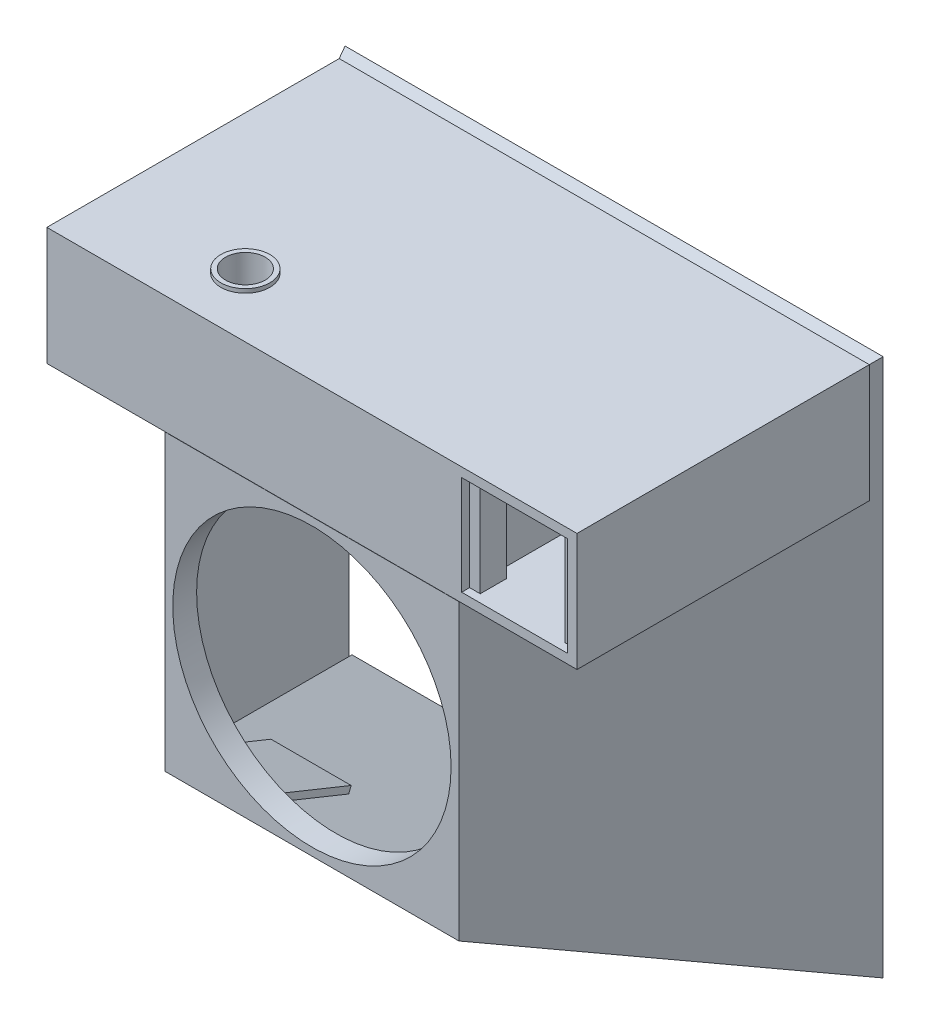
from build123d import *

# Parameters (mm, degrees)
SKETCH4_W            = 203
SKETCH4_H            = 203
BOSS_EXTRUDE4_DEPTH  = 114
BOSS_EXTRUDE4_TAPER  = 22
SKETCH7_R            = 52.5
CUT_EXTRUDE2_DEPTH   = 89
SKETCH12_W           = 200
SKETCH12_H           = 200
CUT_EXTRUDE3_DEPTH   = 105
CUT_EXTRUDE3_DRAFT   = -22
BOSS_EXTRUDE9_REACH  = 185.304
SKETCH23_W           = 200
SKETCH23_H           = 44.466490307
SKETCH28_W           = 193
SKETCH28_H           = 37.466490307
CUT_EXTRUDE6_DEPTH   = 108
SKETCH31_W           = 3
SKETCH31_H           = 37.466490307
BOSS_EXTRUDE11_DEPTH = 108
SKETCH33_W           = 14
SKETCH33_H           = 37.466490307
CUT_EXTRUDE8_DEPTH   = 10
SKETCH36_W           = 150
SKETCH36_H           = 37.466490307
BOSS_EXTRUDE12_DEPTH = 3
SKETCH44_W           = 10
SKETCH44_H           = 37.466490307
BOSS_EXTRUDE16_DEPTH = 4
SKETCH47_W           = 10
SKETCH47_H           = 37.466490307
BOSS_EXTRUDE17_DEPTH = 4
WRAP1_START          = -1
WRAP1_DEPTH          = 1
BOSS_EXTRUDE18_DEPTH = 3
SKETCH61_W           = 25.5
SKETCH61_H           = 26
CUT_EXTRUDE10_DEPTH  = 5.5
SKETCH62_W           = 30.230238596
SKETCH62_H           = 29.812668185
BOSS_EXTRUDE19_DEPTH = 2.5
SKETCH63_W           = 11.364617939
SKETCH63_H           = 5.008060822
CUT_EXTRUDE11_DEPTH  = 5
BOSS_EXTRUDE24_START = -45.96649
SKETCH64_R           = 9.25
SKETCH64_R_2         = 7.5
BOSS_EXTRUDE24_DEPTH = 42.46649
SKETCH68_R           = 7.5
CUT_EXTRUDE15_DEPTH  = 44.466490307


# Read off the part's stored shape, not the designer's step: Wrap1
with BuildPart() as part:
    # Sketch4 → Boss-Extrude4 (new body)
    with BuildSketch(Plane.XY):
        Rectangle(SKETCH4_W, SKETCH4_H)
    extrude(amount=BOSS_EXTRUDE4_DEPTH, taper=BOSS_EXTRUDE4_TAPER)

    # Sketch7 → Cut-Extrude2 (cut)
    with BuildSketch(Plane.XY.offset(114)):
        Circle(SKETCH7_R)
    extrude(amount=-CUT_EXTRUDE2_DEPTH, mode=Mode.SUBTRACT)


with BuildPart() as cut_extrude3_tool:
    # Sketch12 → Cut-Extrude3 (with draft: the straight prism first)
    with BuildSketch(Plane(origin=(0, 0, 0), x_dir=(-1, 0, 0), z_dir=(0, 0, -1))):
        Rectangle(SKETCH12_W, SKETCH12_H)
    extrude(amount=-CUT_EXTRUDE3_DEPTH)
    # Cut-Extrude3: the draft: its side faces are tilted about the plane it starts from
    cut_extrude3_sides = [cut_extrude3_tool.faces().sort_by_distance(p)[0] for p in [
        (100, 0, 52.5),
        (0, -100, 52.5),
        (-100, 0, 52.5),
        (0, 100, 52.5),
    ]]
    draft(cut_extrude3_sides, Plane(origin=(0, 0, 0), x_dir=(-1, 0, 0), z_dir=(0, 0, -1)), CUT_EXTRUDE3_DRAFT)


with BuildPart() as part_1:
    add(part.part)

    # Cut-Extrude3: cut by cut_extrude3_tool
    add(cut_extrude3_tool.part, mode=Mode.SUBTRACT)

    # Boss-Extrude9: up to this face of the body (flat: up to its plane)
    boss_extrude9_end = Plane(part_1.part.faces().sort_by_distance((-53.872901683, 0, 114))[0])
    # Sketch23 → Boss-Extrude9 (add, up to the picked face)
    with BuildSketch(Plane(origin=(0, 0, 0), x_dir=(-1, 0, 0), z_dir=(0, 0, -1)), mode=Mode.PRIVATE) as boss_extrude9_sk1:
        with Locations((0, 77.766754847)):
            Rectangle(SKETCH23_W, SKETCH23_H)
    boss_extrude9_tool1 = split(extrude(boss_extrude9_sk1.sketch, amount=-BOSS_EXTRUDE9_REACH, mode=Mode.PRIVATE), bisect_by=boss_extrude9_end, keep=Keep.BOTH, mode=Mode.PRIVATE)
    add(boss_extrude9_tool1.solids().sort_by(Axis((0, 77.766755, 0), (0, 0, 1)))[0])

    # Sketch28 → Cut-Extrude6 (cut)
    with BuildSketch(Plane.XY.offset(114)):
        with Locations((0, 77.766754847)):
            Rectangle(SKETCH28_W, SKETCH28_H)
    extrude(amount=-CUT_EXTRUDE6_DEPTH, mode=Mode.SUBTRACT)

    # Sketch31 → Boss-Extrude11 (add)
    with BuildSketch(Plane.XY.offset(114)):
        with Locations((55, 77.766754847)):
            Rectangle(SKETCH31_W, SKETCH31_H)
    extrude(amount=-BOSS_EXTRUDE11_DEPTH)

    # Sketch33 → Cut-Extrude8 (cut)
    with BuildSketch(Plane(origin=(56.5, 0, 0), x_dir=(0, 0, -1), z_dir=(1, 0, 0))):
        with Locations((-13, 77.766754847)):
            Rectangle(SKETCH33_W, SKETCH33_H)
    extrude(amount=-CUT_EXTRUDE8_DEPTH, mode=Mode.SUBTRACT)

    # Sketch36 → Boss-Extrude12 (add)
    with BuildSketch(Plane.XY.offset(114)):
        with Locations((-21.5, 77.766754847)):
            Rectangle(SKETCH36_W, SKETCH36_H)
    extrude(amount=-BOSS_EXTRUDE12_DEPTH)

    # Sketch44 → Boss-Extrude16 (add)
    with BuildSketch(Plane(origin=(56.5, 0, 0), x_dir=(0, 0, -1), z_dir=(1, 0, 0))):
        with Locations((-106, 77.766754847)):
            Rectangle(SKETCH44_W, SKETCH44_H)
    extrude(amount=BOSS_EXTRUDE16_DEPTH)

    # Sketch47 → Boss-Extrude17 (add)
    with BuildSketch(Plane.ZY.offset(-96.5)):
        with Locations((106, 77.766754847)):
            Rectangle(SKETCH47_W, SKETCH47_H)
    extrude(amount=BOSS_EXTRUDE17_DEPTH)

    # Wrap1 outline → Wrap1 (cut)
    with BuildSketch(Plane(origin=(0, -87.256494867, 35.253912301), x_dir=(1, 0, 0), z_dir=(0, -0.9271838545667873, 0.3746065934159124)).offset(WRAP1_START)):
        with BuildLine():
            Line((-4.680234593, 75.476918312), (-5.241387393, 74.994297512))
            Line((-5.241387393, 74.994297512), (-5.341387393, 58.729844912))
            Line((-5.341387393, 58.729844912), (-5.441387393, 42.465392112))
            Line((-5.441387393, 42.465392112), (-6.341387393, 42.040077912))
            ThreePointArc((-6.341387393, 42.040077912), (-6.529680479, 41.952409721), (-6.718963793, 41.866900512))
            ThreePointArc((-6.718963793, 41.866900512), (-6.91363203, 41.781536657), (-7.109199993, 41.698254712))
            ThreePointArc((-7.109199993, 41.698254712), (-7.283738522, 41.626115501), (-7.459034993, 41.555838112))
            ThreePointArc((-7.459034993, 41.555838112), (-7.574470195, 41.512660542), (-7.691387393, 41.473673912))
            Line((-7.691387393, 41.473673912), (-8.141387393, 41.332584112))
            Line((-8.141387393, 41.332584112), (-8.141387393, 53.919089912))
            Line((-8.141387393, 53.919089912), (-8.148984393, 62.129109112))
            ThreePointArc((-8.148984393, 62.129109112), (-8.161799654, 63.524890433), (-8.195074593, 64.920333912))
            ThreePointArc((-8.195074593, 64.920333912), (-8.231464824, 65.658378419), (-8.294533793, 66.394623112))
            ThreePointArc((-8.294533793, 66.394623112), (-8.377628864, 66.727977707), (-8.550053593, 67.025130512))
            ThreePointArc((-8.550053593, 67.025130512), (-8.868939679, 67.331350627), (-9.259677793, 67.538190712))
            ThreePointArc((-9.259677793, 67.538190712), (-9.729366325, 67.653556638), (-10.212837593, 67.666677112))
            ThreePointArc((-10.212837593, 67.666677112), (-10.685797535, 67.577066864), (-11.128743793, 67.388600112))
            ThreePointArc((-11.128743793, 67.388600112), (-11.476401599, 67.123101366), (-11.735458593, 66.770617312))
            ThreePointArc((-11.735458593, 66.770617312), (-11.807487772, 66.586548858), (-11.834326993, 66.390719712))
            Line((-11.834326993, 66.390719712), (-11.889242393, 62.996599712))
            ThreePointArc((-11.889242393, 62.996599712), (-11.915000566, 60.83331555), (-11.929331993, 58.669925512))
            ThreePointArc((-11.929331993, 58.669925512), (-11.938374335, 55.643182116), (-11.941387393, 52.616426712))
            Line((-11.941387393, 52.616426712), (-11.941387393, 38.847017712))
            Line((-11.941387393, 38.847017712), (-13.097186793, 37.703278512))
            Line((-13.097186793, 37.703278512), (-14.252986393, 36.559539112))
            Line((-14.252986393, 36.559539112), (-27.647186793, 36.558423712))
            ThreePointArc((-27.647186793, 36.558423712), (-30.544657603, 36.555032755), (-33.442114193, 36.545342712))
            ThreePointArc((-33.442114193, 36.545342712), (-35.6022346, 36.530228145), (-37.762248993, 36.504028112))
            ThreePointArc((-37.762248993, 36.504028112), (-39.44769809, 36.47716338), (-41.133075193, 36.446108712))
            ThreePointArc((-41.133075193, 36.446108712), (-41.462284705, 36.418895447), (-41.785490793, 36.350651112))
            ThreePointArc((-41.785490793, 36.350651112), (-42.334677536, 36.102524179), (-42.783236593, 35.700071912))
            ThreePointArc((-42.783236593, 35.700071912), (-43.071277133, 35.193449783), (-43.174916393, 34.619958512))
            ThreePointArc((-43.174916393, 34.619958512), (-43.084000838, 34.029386826), (-42.809333593, 33.498728312))
            ThreePointArc((-42.809333593, 33.498728312), (-42.368210042, 33.054523148), (-41.820380793, 32.751552312))
            ThreePointArc((-41.820380793, 32.751552312), (-41.606201768, 32.690641181), (-41.384746593, 32.667394112))
            Line((-41.384746593, 32.667394112), (-38.099396193, 32.612398912))
            ThreePointArc((-38.099396193, 32.612398912), (-36.113863069, 32.587344797), (-34.128229193, 32.572258312))
            ThreePointArc((-34.128229193, 32.572258312), (-31.628306382, 32.5627188), (-29.128367393, 32.559539112))
            ThreePointArc((-29.128367393, 32.559539112), (-26.515875807, 32.556582532), (-23.903397593, 32.547716512))
            ThreePointArc((-23.903397593, 32.547716512), (-22.006958741, 32.533681109), (-20.110631993, 32.508737712))
            Line((-20.110631993, 32.508737712), (-17.032274193, 32.456704512))
            ThreePointArc((-17.032274193, 32.456704512), (-16.967910321, 32.429033235), (-16.941387393, 32.364187712))
            ThreePointArc((-16.941387393, 32.364187712), (-16.946335906, 32.300713476), (-16.961061993, 32.238773112))
            ThreePointArc((-16.961061993, 32.238773112), (-17.016387974, 32.069981807), (-17.073574993, 31.901811912))
            ThreePointArc((-17.073574993, 31.901811912), (-17.144763299, 31.701201666), (-17.219027193, 31.501709512))
            ThreePointArc((-17.219027193, 31.501709512), (-17.303956995, 31.282594948), (-17.391387393, 31.064466112))
            Line((-17.391387393, 31.064466112), (-17.841387393, 29.960096112))
            Line((-17.841387393, 29.960096112), (-33.946886193, 29.959817712))
            ThreePointArc((-33.946886193, 29.959817712), (-39.956743456, 29.956289928), (-45.966592793, 29.945910912))
            ThreePointArc((-45.966592793, 29.945910912), (-47.481548941, 29.916541952), (-48.994617193, 29.835430112))
            ThreePointArc((-48.994617193, 29.835430112), (-49.726567259, 29.723321068), (-50.430695593, 29.494142912))
            ThreePointArc((-50.430695593, 29.494142912), (-50.909204595, 29.187170197), (-51.253998393, 28.735152112))
            ThreePointArc((-51.253998393, 28.735152112), (-51.332481236, 28.570102999), (-51.399777193, 28.400185312))
            ThreePointArc((-51.399777193, 28.400185312), (-51.438653984, 28.26249036), (-51.458351193, 28.120774712))
            ThreePointArc((-51.458351193, 28.120774712), (-51.458756257, 27.975408689), (-51.439798993, 27.831283512))
            ThreePointArc((-51.439798993, 27.831283512), (-51.396789499, 27.645814704), (-51.342625793, 27.463291312))
            ThreePointArc((-51.342625793, 27.463291312), (-51.292199131, 27.323463558), (-51.234204993, 27.186601112))
            ThreePointArc((-51.234204993, 27.186601112), (-51.166378222, 27.046956148), (-51.091927993, 26.910727112))
            ThreePointArc((-51.091927993, 26.910727112), (-51.018401504, 26.79050454), (-50.939019993, 26.674064912))
            ThreePointArc((-50.939019993, 26.674064912), (-50.874502146, 26.595383057), (-50.800508993, 26.525537512))
            ThreePointArc((-50.800508993, 26.525537512), (-50.608993098, 26.414058362), (-50.391624793, 26.370965912))
            ThreePointArc((-50.391624793, 26.370965912), (-48.894982777, 26.328860835), (-47.398194193, 26.292335512))
            ThreePointArc((-47.398194193, 26.292335512), (-45.160954836, 26.249631795), (-42.923474193, 26.222356912))
            ThreePointArc((-42.923474193, 26.222356912), (-38.742126209, 26.188376471), (-34.560739593, 26.159539112))
            Line((-34.560739593, 26.159539112), (-18.641387393, 26.059539112))
            Line((-18.641387393, 26.059539112), (-18.523111393, 23.359539112))
            Line((-18.523111393, 23.359539112), (-34.222838793, 23.359539112))
            ThreePointArc((-34.222838793, 23.359539112), (-37.846448303, 23.356615537), (-41.470048393, 23.347850712))
            ThreePointArc((-41.470048393, 23.347850712), (-43.885292476, 23.333819367), (-46.300431793, 23.307306312))
            ThreePointArc((-46.300431793, 23.307306312), (-48.107470286, 23.280959848), (-49.914451393, 23.250934312))
            ThreePointArc((-49.914451393, 23.250934312), (-50.165030203, 23.22069284), (-50.404210193, 23.140087512))
            ThreePointArc((-50.404210193, 23.140087512), (-50.668842428, 22.981968915), (-50.892142593, 22.769439512))
            ThreePointArc((-50.892142593, 22.769439512), (-51.094565624, 22.48666989), (-51.250745193, 22.175958312))
            ThreePointArc((-51.250745193, 22.175958312), (-51.359105124, 21.839457654), (-51.414935793, 21.490376712))
            ThreePointArc((-51.414935793, 21.490376712), (-51.409094384, 21.167720778), (-51.339126393, 20.852688312))
            ThreePointArc((-51.339126393, 20.852688312), (-51.065945214, 20.381034148), (-50.626617593, 20.058424712))
            ThreePointArc((-50.626617593, 20.058424712), (-49.932382368, 19.813072399), (-49.206039393, 19.692299112))
            ThreePointArc((-49.206039393, 19.692299112), (-47.660935085, 19.600440436), (-46.113531793, 19.563993312))
            ThreePointArc((-46.113531793, 19.563993312), (-40.0630588, 19.533631511), (-34.012552993, 19.510723912))
            Line((-34.012552993, 19.510723912), (-17.866028593, 19.459539112))
            Line((-17.866028593, 19.459539112), (-17.391438993, 18.278925112))
            ThreePointArc((-17.391438993, 18.278925112), (-17.271090802, 17.971158478), (-17.156587193, 17.661169912))
            ThreePointArc((-17.156587193, 17.661169912), (-17.102187056, 17.483654988), (-17.064691593, 17.301817112))
            ThreePointArc((-17.064691593, 17.301817112), (-17.058356126, 17.188682554), (-17.074714193, 17.076557712))
            ThreePointArc((-17.074714193, 17.076557712), (-17.113007791, 16.994228401), (-17.179118393, 16.931987712))
            ThreePointArc((-17.179118393, 16.931987712), (-17.28824273, 16.882251669), (-17.406773193, 16.864021912))
            Line((-17.406773193, 16.864021912), (-20.900208793, 16.813622112))
            ThreePointArc((-20.900208793, 16.813622112), (-22.872478684, 16.790574802), (-24.844827593, 16.775759912))
            ThreePointArc((-24.844827593, 16.775759912), (-27.161588986, 16.766185229), (-29.478367393, 16.762601712))
            ThreePointArc((-29.478367393, 16.762601712), (-31.845656698, 16.758773747), (-34.212926793, 16.748497312))
            ThreePointArc((-34.212926793, 16.748497312), (-36.19915099, 16.732610103), (-38.185281393, 16.707610312))
            Line((-38.185281393, 16.707610312), (-41.601411993, 16.652568112))
            ThreePointArc((-41.601411993, 16.652568112), (-41.802679016, 16.631593813), (-41.997331793, 16.576288912))
            ThreePointArc((-41.997331793, 16.576288912), (-42.271208222, 16.453890204), (-42.529395193, 16.301151112))
            ThreePointArc((-42.529395193, 16.301151112), (-42.722257732, 16.142335786), (-42.880608593, 15.949091712))
            ThreePointArc((-42.880608593, 15.949091712), (-43.000940593, 15.725393593), (-43.076743393, 15.482958912))
            ThreePointArc((-43.076743393, 15.482958912), (-43.12518256, 15.174676159), (-43.141387393, 14.863032112))
            ThreePointArc((-43.141387393, 14.863032112), (-43.134668892, 14.62426142), (-43.114534593, 14.386246312))
            ThreePointArc((-43.114534593, 14.386246312), (-43.082774058, 14.220088107), (-43.026110393, 14.060693912))
            ThreePointArc((-43.026110393, 14.060693912), (-42.947476318, 13.916071085), (-42.846779193, 13.785843712))
            ThreePointArc((-42.846779193, 13.785843712), (-42.691541114, 13.62624744), (-42.526042393, 13.477317912))
            Line((-42.526042393, 13.477317912), (-41.910697193, 12.959539112))
            Line((-41.910697193, 12.959539112), (-14.429831993, 12.959539112))
            Line((-14.429831993, 12.959539112), (-13.185609793, 11.704158112))
            Line((-13.185609793, 11.704158112), (-11.941387393, 10.448776912))
            Line((-11.941387393, 10.448776912), (-11.941387393, -17.204903488))
            Line((-11.941387393, -17.204903488), (-11.326042393, -17.722682088))
            ThreePointArc((-11.326042393, -17.722682088), (-11.18624759, -17.831480313), (-11.038564993, -17.929304088))
            ThreePointArc((-11.038564993, -17.929304088), (-10.880499797, -18.01797896), (-10.716521993, -18.095174288))
            ThreePointArc((-10.716521993, -18.095174288), (-10.558520454, -18.155891079), (-10.396415793, -18.204605488))
            ThreePointArc((-10.396415793, -18.204605488), (-10.257405052, -18.231460635), (-10.116110393, -18.240460888))
            ThreePointArc((-10.116110393, -18.240460888), (-9.835850925, -18.222160448), (-9.560351193, -18.167569488))
            ThreePointArc((-9.560351193, -18.167569488), (-9.265832151, -18.073303616), (-8.981934793, -17.950707488))
            ThreePointArc((-8.981934793, -17.950707488), (-8.734850312, -17.813292059), (-8.503031393, -17.651447288))
            ThreePointArc((-8.503031393, -17.651447288), (-8.362438492, -17.507716024), (-8.265623593, -17.331500488))
            ThreePointArc((-8.265623593, -17.331500488), (-8.228421539, -17.200888565), (-8.214913593, -17.065755288))
            Line((-8.214913593, -17.065755288), (-8.177881793, -13.435778888))
            ThreePointArc((-8.177881793, -13.435778888), (-8.161047829, -11.384485159), (-8.150343193, -9.333150288))
            ThreePointArc((-8.150343193, -9.333150288), (-8.143626681, -6.928631057), (-8.141387393, -4.524103488))
            ThreePointArc((-8.141387393, -4.524103488), (-8.138413382, -1.878999803), (-8.129493193, 0.766090512))
            ThreePointArc((-8.129493193, 0.766090512), (-8.115385489, 2.717423218), (-8.090615993, 4.668649712))
            Line((-8.090615993, 4.668649712), (-8.038761793, 7.871081312))
            ThreePointArc((-8.038761793, 7.871081312), (-8.011877512, 7.933720698), (-7.948791326, 7.959539112))
            ThreePointArc((-7.948791326, 7.959539112), (-7.738016354, 7.940012808), (-7.534415393, 7.882098712))
            ThreePointArc((-7.534415393, 7.882098712), (-7.082489752, 7.701781788), (-6.634311593, 7.512342312))
            ThreePointArc((-6.634311593, 7.512342312), (-6.182765652, 7.31170656), (-5.734522393, 7.103796912))
            ThreePointArc((-5.734522393, 7.103796912), (-5.600561326, 7.015484081), (-5.496336193, 6.893492912))
            ThreePointArc((-5.496336193, 6.893492912), (-5.451445687, 6.794949915), (-5.435344793, 6.687867512))
            Line((-5.435344793, 6.687867512), (-5.390329793, 2.105525112))
            ThreePointArc((-5.390329793, 2.105525112), (-5.369628342, -0.460759846), (-5.356338393, -3.027093888))
            ThreePointArc((-5.356338393, -3.027093888), (-5.347716914, -6.052262127), (-5.344449993, -9.077440888))
            ThreePointArc((-5.344449993, -9.077440888), (-5.340745903, -12.549820458), (-5.330985993, -16.022188288))
            ThreePointArc((-5.330985993, -16.022188288), (-5.316102567, -18.502457888), (-5.289725793, -20.982631888))
            Line((-5.289725793, -20.982631888), (-5.233295593, -24.841820888))
            ThreePointArc((-5.233295593, -24.841820888), (-5.205994224, -25.105820238), (-5.133524393, -25.361141888))
            ThreePointArc((-5.133524393, -25.361141888), (-5.017819469, -25.615967199), (-4.871056393, -25.854261488))
            ThreePointArc((-4.871056393, -25.854261488), (-4.713748415, -26.03594368), (-4.523864593, -26.183247288))
            ThreePointArc((-4.523864593, -26.183247288), (-4.29823906, -26.297834873), (-4.055576393, -26.369612488))
            ThreePointArc((-4.055576393, -26.369612488), (-3.742434915, -26.416705654), (-3.426250193, -26.434100288))
            ThreePointArc((-3.426250193, -26.434100288), (-3.215352971, -26.429003544), (-3.005212193, -26.410443688))
            ThreePointArc((-3.005212193, -26.410443688), (-2.840837742, -26.379945168), (-2.681639593, -26.328905288))
            ThreePointArc((-2.681639593, -26.328905288), (-2.537518928, -26.260743665), (-2.403991793, -26.173638688))
            ThreePointArc((-2.403991793, -26.173638688), (-2.259808926, -26.054943972), (-2.126250193, -25.924409688))
            Line((-2.126250193, -25.924409688), (-1.641387393, -25.408358488))
            Line((-1.641387393, -25.408358488), (-1.534333393, 6.359539112))
            Line((-1.534333393, 6.359539112), (-0.237860393, 6.359539112))
            ThreePointArc((-0.237860393, 6.359539112), (0.055531048, 6.356061297), (0.348757607, 6.345629712))
            ThreePointArc((0.348757607, 6.345629712), (0.550612051, 6.329046196), (0.750839207, 6.298561512))
            ThreePointArc((0.750839207, 6.298561512), (0.880474906, 6.267148347), (1.006141407, 6.222425512))
            ThreePointArc((1.006141407, 6.222425512), (1.064700737, 6.177559148), (1.093257007, 6.109539112))
            ThreePointArc((1.093257007, 6.109539112), (1.103743225, 6.010077783), (1.107715407, 5.910144112))
            Line((1.107715407, 5.910144112), (1.126595607, 3.171726712))
            Line((1.126595607, 3.171726712), (1.144026007, 0.081111912))
            Line((1.144026007, 0.081111912), (1.158100607, -3.540460888))
            Line((1.158100607, -3.540460888), (1.172233807, -7.597563288))
            Line((1.172233807, -7.597563288), (1.189756007, -12.017818888))
            Line((1.189756007, -12.017818888), (1.207852407, -16.144242888))
            Line((1.207852407, -16.144242888), (1.223456207, -19.199551888))
            Line((1.223456207, -19.199551888), (1.258612607, -25.458642688))
            Line((1.258612607, -25.458642688), (1.749521607, -25.949551888))
            ThreePointArc((1.749521607, -25.949551888), (1.886376712, -26.074436825), (2.034059207, -26.186309288))
            ThreePointArc((2.034059207, -26.186309288), (2.175220636, -26.270401177), (2.326135407, -26.335383688))
            ThreePointArc((2.326135407, -26.335383688), (2.497503337, -26.385314808), (2.673483407, -26.415166088))
            ThreePointArc((2.673483407, -26.415166088), (2.902264417, -26.43413243), (3.131743007, -26.440460888))
            ThreePointArc((3.131743007, -26.440460888), (3.378391981, -26.433907859), (3.624345007, -26.414266888))
            ThreePointArc((3.624345007, -26.414266888), (3.792574221, -26.383198495), (3.954117807, -26.326895888))
            ThreePointArc((3.954117807, -26.326895888), (4.099349804, -26.248813661), (4.229972207, -26.148180888))
            ThreePointArc((4.229972207, -26.148180888), (4.390787532, -25.991829518), (4.540833807, -25.825115888))
            Line((4.540833807, -25.825115888), (5.058612607, -25.209770688))
            Line((5.058612607, -25.209770688), (5.058969807, 7.059539112))
            Line((5.058969807, 7.059539112), (6.284630807, 7.505372712))
            ThreePointArc((6.284630807, 7.505372712), (6.524808336, 7.589629021), (6.766856207, 7.668351312))
            ThreePointArc((6.766856207, 7.668351312), (6.983143918, 7.732068348), (7.201413607, 7.788624312))
            ThreePointArc((7.201413607, 7.788624312), (7.380964657, 7.829676817), (7.561469807, 7.866307112))
            ThreePointArc((7.561469807, 7.866307112), (7.625093017, 7.866469657), (7.684452207, 7.843569312))
            ThreePointArc((7.684452207, 7.843569312), (7.736296541, 7.789737175), (7.755894607, 7.717614712))
            Line((7.755894607, 7.717614712), (7.807485207, 4.098630312))
            ThreePointArc((7.807485207, 4.098630312), (7.831153818, 2.069749936), (7.846094007, 0.040786512))
            ThreePointArc((7.846094007, 0.040786512), (7.855482202, -2.360505632), (7.858612607, -4.761814088))
            Line((7.858612607, -4.761814088), (7.858612607, -17.259560488))
            Line((7.858612607, -17.259560488), (8.366580007, -17.730328688))
            ThreePointArc((8.366580007, -17.730328688), (8.616191975, -17.938121774), (8.886454007, -18.118239888))
            ThreePointArc((8.886454007, -18.118239888), (9.13664473, -18.239176533), (9.403598807, -18.316355488))
            ThreePointArc((9.403598807, -18.316355488), (9.662862891, -18.343598098), (9.922721207, -18.322773088))
            ThreePointArc((9.922721207, -18.322773088), (10.192216668, -18.254379145), (10.448197607, -18.145846688))
            ThreePointArc((10.448197607, -18.145846688), (10.883273376, -17.8212197), (11.190777407, -17.373877688))
            ThreePointArc((11.190777407, -17.373877688), (11.419307562, -16.74581474), (11.532400007, -16.087104488))
            ThreePointArc((11.532400007, -16.087104488), (11.614375066, -14.747550537), (11.644226007, -13.405822688))
            ThreePointArc((11.644226007, -13.405822688), (11.655018082, -8.279368138), (11.658612607, -3.152903488))
            Line((11.658612607, -3.152903488), (11.658612607, 10.645651512))
            Line((11.658612607, 10.645651512), (14.158612607, 12.996149112))
            Line((14.158612607, 12.996149112), (26.958612607, 12.857495712))
            ThreePointArc((26.958612607, 12.857495712), (29.447125396, 12.833448212), (31.935687607, 12.815218912))
            ThreePointArc((31.935687607, 12.815218912), (34.113253166, 12.805602653), (36.290839007, 12.803568712))
            Line((36.290839007, 12.803568712), (40.016740807, 12.812079712))
            ThreePointArc((40.016740807, 12.812079712), (40.386113524, 12.826929146), (40.753426207, 12.868619712))
            ThreePointArc((40.753426207, 12.868619712), (41.368966818, 13.023761045), (41.942800807, 13.295189912))
            ThreePointArc((41.942800807, 13.295189912), (42.377263427, 13.647080657), (42.696192807, 14.106285312))
            ThreePointArc((42.696192807, 14.106285312), (42.85121065, 14.598451804), (42.843109007, 15.114390512))
            ThreePointArc((42.843109007, 15.114390512), (42.675653497, 15.637763887), (42.376007007, 16.098386312))
            Line((42.376007007, 16.098386312), (41.893401407, 16.659539112))
            Line((41.893401407, 16.659539112), (29.431518807, 16.714027312))
            ThreePointArc((29.431518807, 16.714027312), (27.036893959, 16.727302734), (24.642306807, 16.746191112))
            ThreePointArc((24.642306807, 16.746191112), (22.613256352, 16.768464718), (20.584306207, 16.798517512))
            Line((20.584306207, 16.798517512), (16.965046207, 16.860593712))
            ThreePointArc((16.965046207, 16.860593712), (16.882757566, 16.878092305), (16.813013207, 16.925138512))
            ThreePointArc((16.813013207, 16.925138512), (16.748150745, 17.035921874), (16.745808207, 17.164275312))
            ThreePointArc((16.745808207, 17.164275312), (16.854729637, 17.592028488), (16.973773807, 18.017075712))
            ThreePointArc((16.973773807, 18.017075712), (17.104659566, 18.43467505), (17.251135007, 18.847064712))
            ThreePointArc((17.251135007, 18.847064712), (17.363612886, 19.08825204), (17.511446007, 19.309539112))
            ThreePointArc((17.511446007, 19.309539112), (17.637965667, 19.412725588), (17.796492807, 19.451761712))
            ThreePointArc((17.796492807, 19.451761712), (19.390275067, 19.481860734), (20.984124607, 19.508156912))
            ThreePointArc((20.984124607, 19.508156912), (23.284262484, 19.536005862), (25.584531407, 19.549147312))
            ThreePointArc((25.584531407, 19.549147312), (29.715104139, 19.556941344), (33.845683407, 19.559539112))
            Line((33.845683407, 19.559539112), (49.983776207, 19.559539112))
            Line((49.983776207, 19.559539112), (50.521194407, 20.120482912))
            ThreePointArc((50.521194407, 20.120482912), (50.756917718, 20.417109128), (50.934059807, 20.752031912))
            ThreePointArc((50.934059807, 20.752031912), (51.043558572, 21.109147106), (51.082536007, 21.480633312))
            ThreePointArc((51.082536007, 21.480633312), (51.049202115, 21.843036509), (50.944692807, 22.191640912))
            ThreePointArc((50.944692807, 22.191640912), (50.774755367, 22.504628407), (50.542561407, 22.774676312))
            Line((50.542561407, 22.774676312), (50.026510207, 23.259539112))
            Line((50.026510207, 23.259539112), (34.133504007, 23.313072312))
            Line((34.133504007, 23.313072312), (18.240497807, 23.366605312))
            Line((18.240497807, 23.366605312), (18.299555207, 24.713072312))
            Line((18.299555207, 24.713072312), (18.358612607, 26.059539112))
            Line((18.358612607, 26.059539112), (34.258612607, 26.162551312))
            Line((34.258612607, 26.162551312), (40.358357407, 26.205427912))
            Line((40.358357407, 26.205427912), (45.500386407, 26.249106312))
            Line((45.500386407, 26.249106312), (50.157600207, 26.293032112))
            ThreePointArc((50.157600207, 26.293032112), (50.181264249, 26.298244994), (50.200821607, 26.312551312))
            Line((50.200821607, 26.312551312), (50.231032007, 26.345649912))
            Line((50.231032007, 26.345649912), (50.350420207, 26.474314312))
            Line((50.350420207, 26.474314312), (50.491518007, 26.626136912))
            Line((50.491518007, 26.626136912), (50.650821607, 26.797251312))
            ThreePointArc((50.650821607, 26.797251312), (50.838252333, 27.048963765), (50.966249007, 27.335505712))
            ThreePointArc((50.966249007, 27.335505712), (51.042665778, 27.669205507), (51.061517607, 28.011023712))
            ThreePointArc((51.061517607, 28.011023712), (51.022018026, 28.36395328), (50.925741007, 28.705786912))
            ThreePointArc((50.925741007, 28.705786912), (50.77716825, 29.017614717), (50.575977407, 29.298386312))
            Line((50.575977407, 29.298386312), (50.093342007, 29.859539112))
            Line((50.093342007, 29.859539112), (33.789061007, 29.912976712))
            Line((33.789061007, 29.912976712), (17.484779807, 29.966414512))
            Line((17.484779807, 29.966414512), (17.071696207, 31.070479312))
            ThreePointArc((17.071696207, 31.070479312), (16.991430005, 31.288519383), (16.913476407, 31.507396912))
            ThreePointArc((16.913476407, 31.507396912), (16.84529743, 31.706609781), (16.779956007, 31.906771312))
            ThreePointArc((16.779956007, 31.906771312), (16.727432626, 32.074574126), (16.676618807, 32.242902512))
            ThreePointArc((16.676618807, 32.242902512), (16.663137572, 32.304322565), (16.658612607, 32.367041712))
            ThreePointArc((16.658612607, 32.367041712), (16.68437336, 32.430006411), (16.746880607, 32.456858112))
            Line((16.746880607, 32.456858112), (19.874103407, 32.508749312))
            ThreePointArc((19.874103407, 32.508749312), (21.779499963, 32.533518247), (23.685005207, 32.547635712))
            ThreePointArc((23.685005207, 32.547635712), (26.265292045, 32.556562491), (28.845592607, 32.559539112))
            ThreePointArc((28.845592607, 32.559539112), (31.345531596, 32.5627188), (33.845454407, 32.572258312))
            ThreePointArc((33.845454407, 32.572258312), (35.831088283, 32.587344797), (37.816621407, 32.612398912))
            Line((37.816621407, 32.612398912), (41.101971807, 32.667394112))
            ThreePointArc((41.101971807, 32.667394112), (41.323426982, 32.690641181), (41.537606007, 32.751552312))
            ThreePointArc((41.537606007, 32.751552312), (41.932417679, 32.948859039), (42.280092607, 33.220756712))
            ThreePointArc((42.280092607, 33.220756712), (42.55581434, 33.549405806), (42.753985607, 33.929880312))
            ThreePointArc((42.753985607, 33.929880312), (42.863530774, 34.340267102), (42.880526407, 34.764682712))
            ThreePointArc((42.880526407, 34.764682712), (42.805094373, 35.189722944), (42.642514407, 35.589619112))
            ThreePointArc((42.642514407, 35.589619112), (42.333662621, 35.959080587), (41.903187407, 36.174909912))
            ThreePointArc((41.903187407, 36.174909912), (41.114186703, 36.343830151), (40.312452807, 36.434818712))
            ThreePointArc((40.312452807, 36.434818712), (38.725156977, 36.512558342), (37.136236607, 36.542283112))
            ThreePointArc((37.136236607, 36.542283112), (32.328543946, 36.555223619), (27.520835807, 36.559539112))
            Line((27.520835807, 36.559539112), (13.970211607, 36.559539112))
            Line((13.970211607, 36.559539112), (12.814412007, 37.703278512))
            Line((12.814412007, 37.703278512), (11.658612607, 38.847017712))
            Line((11.658612607, 38.847017712), (11.658612607, 52.513210312))
            ThreePointArc((11.658612607, 52.513210312), (11.654463357, 57.540065157), (11.642019807, 62.566906312))
            ThreePointArc((11.642019807, 62.566906312), (11.61017791, 64.013391022), (11.524244007, 65.457671912))
            ThreePointArc((11.524244007, 65.457671912), (11.413500593, 66.159716703), (11.194598607, 66.835891912))
            ThreePointArc((11.194598607, 66.835891912), (10.909084979, 67.264092911), (10.481254007, 67.550160712))
            ThreePointArc((10.481254007, 67.550160712), (10.186469286, 67.645857351), (9.880318407, 67.694101712))
            ThreePointArc((9.880318407, 67.694101712), (9.569688925, 67.69386178), (9.262895207, 67.645196112))
            ThreePointArc((9.262895207, 67.645196112), (8.972631033, 67.550468215), (8.701128407, 67.410779312))
            ThreePointArc((8.701128407, 67.410779312), (8.463864621, 67.233255552), (8.261049807, 67.017211712))
            ThreePointArc((8.261049807, 67.017211712), (8.091427199, 66.724519042), (8.010144207, 66.396138312))
            ThreePointArc((8.010144207, 66.396138312), (7.948298281, 65.660050767), (7.912304407, 64.922247112))
            ThreePointArc((7.912304407, 64.922247112), (7.879149866, 63.534537663), (7.866319407, 62.146491512))
            Line((7.866319407, 62.146491512), (7.858612607, 54.126290512))
            Line((7.858612607, 54.126290512), (7.849441607, 47.099283312))
            ThreePointArc((7.849441607, 47.099283312), (7.836718225, 45.489210863), (7.806951807, 43.879363312))
            ThreePointArc((7.806951807, 43.879363312), (7.779150682, 42.882672459), (7.743165807, 41.886243512))
            ThreePointArc((7.743165807, 41.886243512), (7.690250921, 41.732386443), (7.561464007, 41.632958512))
            ThreePointArc((7.561464007, 41.632958512), (7.473475354, 41.611920136), (7.383043807, 41.614518512))
            ThreePointArc((7.383043807, 41.614518512), (7.204621107, 41.647060996), (7.027640207, 41.686702312))
            ThreePointArc((7.027640207, 41.686702312), (6.815268748, 41.74355106), (6.605502007, 41.809363912))
            ThreePointArc((6.605502007, 41.809363912), (6.382072942, 41.888944551), (6.161464007, 41.976038312))
            Line((6.161464007, 41.976038312), (5.058612607, 42.433144712))
            Line((5.058612607, 42.433144712), (5.058612607, 74.790308312))
            Line((5.058612607, 74.790308312), (4.473997207, 75.374923712))
            ThreePointArc((4.473997207, 75.374923712), (4.320292049, 75.518627018), (4.157279607, 75.651679112))
            ThreePointArc((4.157279607, 75.651679112), (4.012260168, 75.749356996), (3.856881807, 75.829539112))
            ThreePointArc((3.856881807, 75.829539112), (3.699477328, 75.888180375), (3.536059407, 75.927033312))
            ThreePointArc((3.536059407, 75.927033312), (3.348034573, 75.951397732), (3.158612607, 75.959539112))
            ThreePointArc((3.158612607, 75.959539112), (2.969190641, 75.951397732), (2.781165807, 75.927033312))
            ThreePointArc((2.781165807, 75.927033312), (2.617747886, 75.888180375), (2.460343407, 75.829539112))
            ThreePointArc((2.460343407, 75.829539112), (2.304965046, 75.749356996), (2.159945607, 75.651679112))
            ThreePointArc((2.159945607, 75.651679112), (1.996933165, 75.518627018), (1.843228007, 75.374923712))
            ThreePointArc((1.843228007, 75.374923712), (1.566045464, 74.997378012), (1.414680807, 74.554140312))
            ThreePointArc((1.414680807, 74.554140312), (1.304763661, 73.778709402), (1.251167607, 72.997362912))
            ThreePointArc((1.251167607, 72.997362912), (1.21343251, 71.400236725), (1.203497407, 69.802695712))
            Line((1.203497407, 69.802695712), (1.242910807, 56.809539112))
            Line((1.242910807, 56.809539112), (1.291835007, 43.159539112))
            Line((1.291835007, 43.159539112), (-1.541387393, 43.159539112))
            Line((-1.541387393, 43.159539112), (-1.541387393, 58.665962912))
            ThreePointArc((-1.541387393, 58.665962912), (-1.54544633, 64.18752199), (-1.557632993, 69.709069112))
            ThreePointArc((-1.557632993, 69.709069112), (-1.586434715, 71.466178157), (-1.662480193, 73.221877112))
            ThreePointArc((-1.662480193, 73.221877112), (-1.751317637, 74.101975589), (-1.916925193, 74.970905712))
            ThreePointArc((-1.916925193, 74.970905712), (-2.131058716, 75.421077125), (-2.511307393, 75.743440912))
            ThreePointArc((-2.511307393, 75.743440912), (-2.769350398, 75.855837265), (-3.042088593, 75.925357112))
            ThreePointArc((-3.042088593, 75.925357112), (-3.33197237, 75.95331992), (-3.622845593, 75.938922312))
            ThreePointArc((-3.622845593, 75.938922312), (-3.911886889, 75.882088184), (-4.189803593, 75.784429112))
            ThreePointArc((-4.189803593, 75.784429112), (-4.446591647, 75.649130102), (-4.680234593, 75.476918312))
        make_face()
        with BuildLine():
            ThreePointArc((-1.628768793, 39.086576512), (0.863800802, 39.138901562), (3.325290007, 38.743032912))
            ThreePointArc((3.325290007, 38.743032912), (4.697361462, 38.316601203), (6.018151207, 37.750970112))
            ThreePointArc((6.018151207, 37.750970112), (7.321331051, 37.034216441), (8.552186607, 36.199346312))
            ThreePointArc((8.552186607, 36.199346312), (9.690246699, 35.260962277), (10.735307407, 34.220004312))
            ThreePointArc((10.735307407, 34.220004312), (11.623139451, 33.134957424), (12.387315007, 31.959539112))
            ThreePointArc((12.387315007, 31.959539112), (13.083159513, 30.561923311), (13.607078407, 29.091196112))
            ThreePointArc((13.607078407, 29.091196112), (13.984183842, 27.489268374), (14.195731607, 25.857205712))
            ThreePointArc((14.195731607, 25.857205712), (14.238579945, 24.224510737), (14.113287207, 22.596066512))
            ThreePointArc((14.113287207, 22.596066512), (13.822993332, 21.097685929), (13.346517607, 19.647725312))
            ThreePointArc((13.346517607, 19.647725312), (12.658168317, 18.147159339), (11.824800607, 16.722020312))
            ThreePointArc((11.824800607, 16.722020312), (10.887463323, 15.450255656), (9.812730807, 14.292267512))
            ThreePointArc((9.812730807, 14.292267512), (8.623049471, 13.271413413), (7.324947007, 12.392542112))
            ThreePointArc((7.324947007, 12.392542112), (5.895790362, 11.637351831), (4.395933207, 11.034666512))
            ThreePointArc((4.395933207, 11.034666512), (1.856350869, 10.41785814), (-0.753158593, 10.275059712))
            ThreePointArc((-0.753158593, 10.275059712), (-3.342585006, 10.611388015), (-5.826713393, 11.415969912))
            ThreePointArc((-5.826713393, 11.415969912), (-8.134387921, 12.666745204), (-10.176152393, 14.316290112))
            ThreePointArc((-10.176152393, 14.316290112), (-11.902910015, 16.32256056), (-13.246389793, 18.603322512))
            ThreePointArc((-13.246389793, 18.603322512), (-13.542065758, 19.280908783), (-13.794212793, 19.975868712))
            ThreePointArc((-13.794212793, 19.975868712), (-14.052368537, 20.817883628), (-14.278597993, 21.669032112))
            ThreePointArc((-14.278597993, 21.669032112), (-14.467429333, 22.505356623), (-14.624574593, 23.348209712))
            ThreePointArc((-14.624574593, 23.348209712), (-14.70636043, 24.001624431), (-14.734431593, 24.659539112))
            ThreePointArc((-14.734431593, 24.659539112), (-14.710980134, 25.293722988), (-14.638607793, 25.924200112))
            ThreePointArc((-14.638607793, 25.924200112), (-14.494027992, 26.772225756), (-14.322535593, 27.615221112))
            ThreePointArc((-14.322535593, 27.615221112), (-14.123451361, 28.455767212), (-13.897646793, 29.289532512))
            ThreePointArc((-13.897646793, 29.289532512), (-13.695209089, 29.905957431), (-13.447905993, 30.505792312))
            ThreePointArc((-13.447905993, 30.505792312), (-12.196716483, 32.721552038), (-10.584288193, 34.690089912))
            ThreePointArc((-10.584288193, 34.690089912), (-8.65454674, 36.358593033), (-6.469089993, 37.674489512))
            ThreePointArc((-6.469089993, 37.674489512), (-4.110027573, 38.58996403), (-1.628768793, 39.086576512))
        make_face(mode=Mode.SUBTRACT)
    extrude(amount=WRAP1_DEPTH, mode=Mode.SUBTRACT)

    # Sketch53 → Boss-Extrude18 (add)
    with BuildSketch(Plane(origin=(0, -85.966990017, 34.732918523), x_dir=(1, 0, 0), z_dir=(0, 0.9271838545667872, -0.37460659341591235))):
        Polygon((-100, 37.460659342), (100, 37.460659342), (57.577246287, -75.78548864), (-57.577246287, -75.78548864), align=None)
    extrude(amount=BOSS_EXTRUDE18_DEPTH)

    # Sketch61 → Cut-Extrude10 (cut)
    with BuildSketch(Plane(origin=(0, -87.256494867, 35.253912301), x_dir=(-1, 0, 0), z_dir=(0, -0.9271838545667873, 0.3746065934159124))):
        with Locations((38.965148772, -61.104228731)):
            Rectangle(SKETCH61_W, SKETCH61_H)
    extrude(amount=-CUT_EXTRUDE10_DEPTH, mode=Mode.SUBTRACT)

    # Sketch62 → Boss-Extrude19 (add)
    with BuildSketch(Plane(origin=(0, -83.185438453, 33.609098743), x_dir=(1, 0, 0), z_dir=(0, 0.9271838545667873, -0.3746065934159123))):
        with Locations((-39.003787882, -60.879154548)):
            Rectangle(SKETCH62_W, SKETCH62_H)
    extrude(amount=BOSS_EXTRUDE19_DEPTH)

    # Sketch63 → Cut-Extrude11 (cut)
    with BuildSketch(Plane(origin=(0, -83.185438453, 33.609098743), x_dir=(-1, 0, 0), z_dir=(0, -0.9271838545667872, 0.37460659341591246))):
        with Locations((38.965148773, -71.60019832)):
            Rectangle(SKETCH63_W, SKETCH63_H)
    extrude(amount=-CUT_EXTRUDE11_DEPTH, mode=Mode.SUBTRACT)

    # Sketch64 → Boss-Extrude24 (add)
    with BuildSketch(Plane(origin=(0, 55.533509693, 0), x_dir=(-1, 0, 0), z_dir=(0, -1, 0)).offset(BOSS_EXTRUDE24_START)):
        with Locations(Location((47.567586448, -91.546345511, 0), (0, 0, 90))):
            Circle(SKETCH64_R)
        with Locations(Location((47.567586448, -91.546345511, 0), (0, 0, 90))):
            Circle(SKETCH64_R_2, mode=Mode.SUBTRACT)
    extrude(amount=BOSS_EXTRUDE24_DEPTH)

    # Sketch68 → Cut-Extrude15 (cut)
    with BuildSketch(Plane(origin=(0, 100, 0), x_dir=(1, 0, 0), z_dir=(0, 1, 0))):
        with Locations(Location((-47.567586448, -91.546345511, 0), (0, 0, 90))):
            Circle(SKETCH68_R)
    extrude(amount=-CUT_EXTRUDE15_DEPTH, mode=Mode.SUBTRACT)


solid = part_1.part
